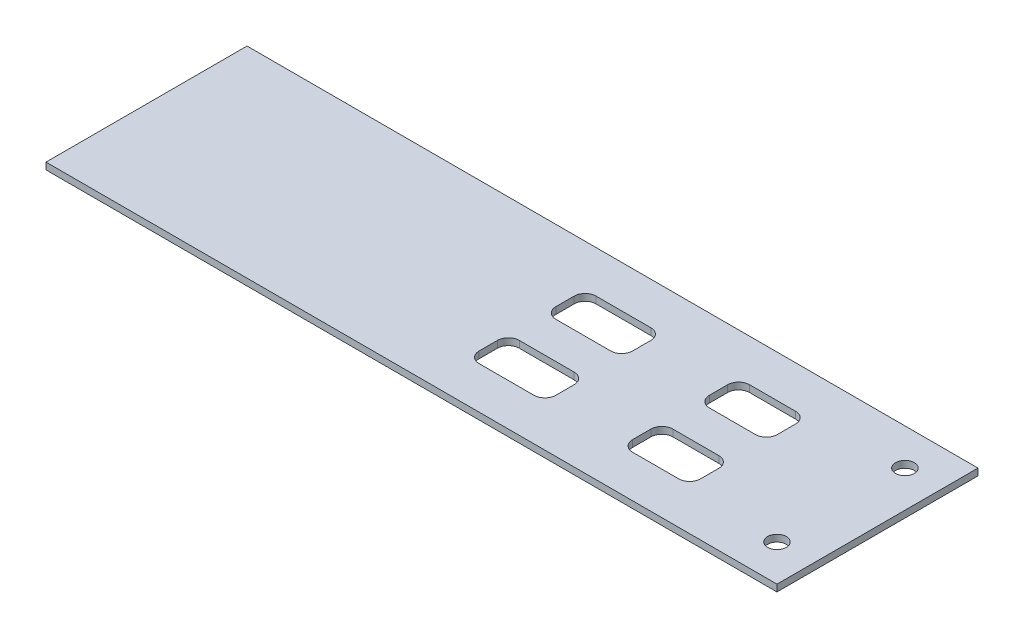
from build123d import *

# Parameters (mm, degrees)
SKETCH1_W           = 152.4
SKETCH1_H           = 69.85
BOSS_EXTRUDE1_DEPTH = 2.3622
SKETCH2_W           = 26.67
SKETCH2_H           = 13.97
SKETCH2_W_2         = 23.622
CUT_EXTRUDE1_DEPTH  = 168.661452006
FILLET1_R           = 3.81
SKETCH4_W           = 69.85
SKETCH4_H           = 2.3622
BOSS_EXTRUDE2_DEPTH = 101.6
SKETCH5_R           = 3.2639
CUT_EXTRUDE2_DEPTH  = 168.661452006


with BuildPart() as part:
    # Sketch1 → Boss-Extrude1 (new body)
    with BuildSketch(Plane(origin=(0, 0, 0), x_dir=(1, 0, 0), z_dir=(0, 1, 0))):
        with Locations((76.2, 34.925)):
            Rectangle(SKETCH1_W, SKETCH1_H)
    extrude(amount=BOSS_EXTRUDE1_DEPTH)

    # Sketch2 → Cut-Extrude1 (cut, through all)
    with BuildSketch(Plane(origin=(0, 2.3622, 0), x_dir=(1, 0, 0), z_dir=(0, 1, 0))):
        with Locations((43.815, 48.26)):
            Rectangle(SKETCH2_W, SKETCH2_H)
        with Locations((95.631, 48.26)):
            Rectangle(SKETCH2_W_2, SKETCH2_H)
        with Locations((43.815, 21.59)):
            Rectangle(SKETCH2_W, SKETCH2_H)
        with Locations((95.631, 21.59)):
            Rectangle(SKETCH2_W_2, SKETCH2_H)
    extrude(amount=-CUT_EXTRUDE1_DEPTH, mode=Mode.SUBTRACT)

    # Fillet1
    fillet1_edges = [part.edges().sort_by_distance(p)[0] for p in [
        (83.82, 1.1811, -14.605),
        (83.82, 1.1811, -41.275),
        (30.48, 1.1811, -41.275),
        (30.48, 1.1811, -14.605),
        (107.442, 1.1811, -14.605),
        (57.15, 1.1811, -41.275),
        (57.15, 1.1811, -14.605),
        (107.442, 1.1811, -41.275),
        (107.442, 1.1811, -28.575),
        (107.442, 1.1811, -55.245),
        (57.15, 1.1811, -28.575),
        (57.15, 1.1811, -55.245),
        (30.48, 1.1811, -28.575),
        (83.82, 1.1811, -28.575),
        (83.82, 1.1811, -55.245),
        (30.48, 1.1811, -55.245),
    ]]
    fillet(fillet1_edges, radius=FILLET1_R)

    # Sketch4 → Boss-Extrude2 (add)
    with BuildSketch(Plane.ZY):
        with Locations((-34.925, 1.1811)):
            Rectangle(SKETCH4_W, SKETCH4_H)
    extrude(amount=BOSS_EXTRUDE2_DEPTH)

    # Sketch5 → Cut-Extrude2 (cut, through all)
    with BuildSketch(Plane.XZ):
        with Locations((139.7, -12.7)):
            Circle(SKETCH5_R)
        with Locations((139.7, -57.15)):
            Circle(SKETCH5_R)
    extrude(amount=-CUT_EXTRUDE2_DEPTH, mode=Mode.SUBTRACT)


solid = part.part
